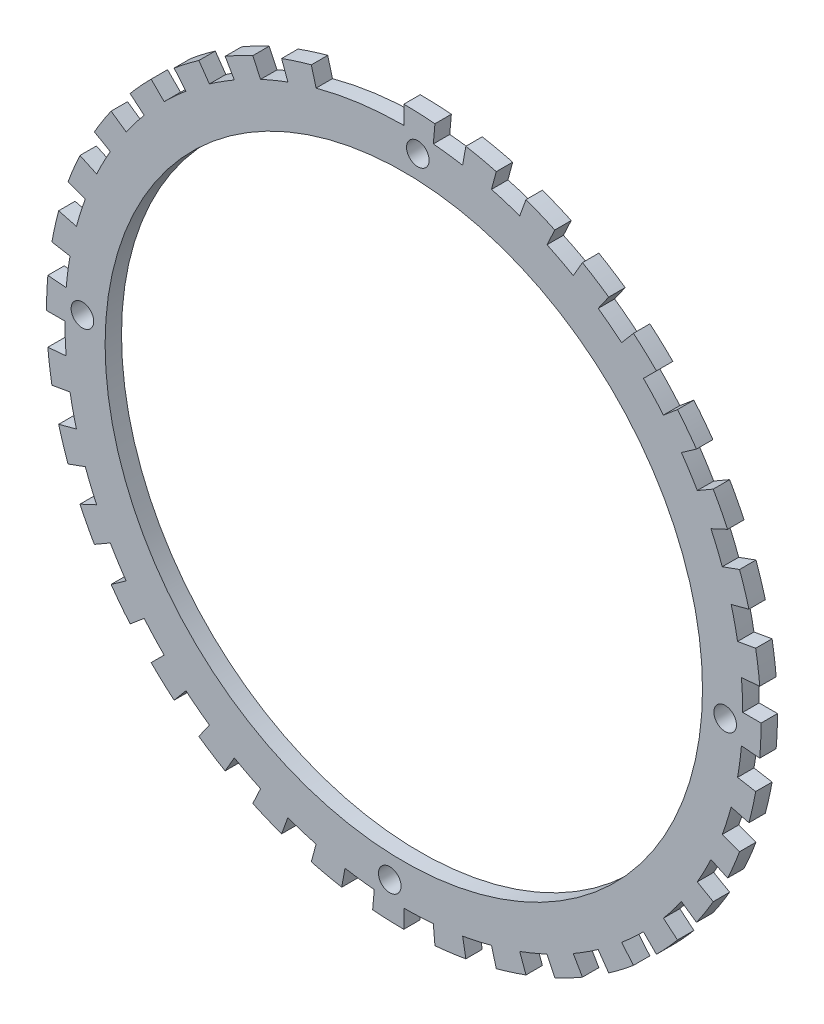
from build123d import *

# Parameters (mm, degrees)
SKETCH1_R           = 65
SKETCH1_R_2         = 2.4585
BOSS_EXTRUDE1_DEPTH = 3.571875


with BuildPart() as part:
    # Sketch1 → Boss-Extrude1 (new body)
    with BuildSketch(Plane.XY):
        with BuildLine():
            Line((0, 77.75), (0, 73.75))
            Line((0, 73.75), (-0.307678606, 73.749358193))
            ThreePointArc((-0.307678606, 73.749358193), (-6.580976275, 73.455791135), (-12.806553103, 72.629571785))
            ThreePointArc((-12.806553103, 72.629571785), (-15.962421528, 72.001830525), (-19.087904576, 71.237029689))
            Line((-19.087904576, 71.237029689), (-20.123180757, 75.100732994))
            ThreePointArc((-20.123180757, 75.100732994), (-23.379875911, 74.151492921), (-26.592066144, 73.061101266))
            Line((-26.592066144, 73.061101266), (-25.22398557, 69.302330783))
            ThreePointArc((-25.22398557, 69.302330783), (-28.222903137, 68.136115523), (-31.168096803, 66.840199294))
            Line((-31.168096803, 66.840199294), (-32.85856985, 70.465430442))
            ThreePointArc((-32.85856985, 70.465430442), (-35.900954679, 68.96509228), (-38.875, 67.333475144))
            Line((-38.875, 67.333475144), (-36.875, 63.869373529))
            ThreePointArc((-36.875, 63.869373529), (-39.625846116, 62.200119129), (-42.301262181, 60.412463266))
            Line((-42.301262181, 60.412463266), (-44.595567926, 63.689071443))
            ThreePointArc((-44.595567926, 63.689071443), (-47.331201105, 61.683222208), (-49.976736653, 59.559955453))
            Line((-49.976736653, 59.559955453), (-47.405586214, 56.49577768))
            ThreePointArc((-47.405586214, 56.49577768), (-49.824777812, 54.37420359), (-52.149125113, 52.149125113))
            Line((-52.149125113, 52.149125113), (-54.977552237, 54.977552237))
            ThreePointArc((-54.977552237, 54.977552237), (-57.323312937, 52.527138642), (-59.559955453, 49.976736653))
            Line((-59.559955453, 49.976736653), (-56.49577768, 47.405586214))
            ThreePointArc((-56.49577768, 47.405586214), (-58.509808846, 44.896155389), (-60.412463266, 42.301262181))
            Line((-60.412463266, 42.301262181), (-63.689071443, 44.595567926))
            ThreePointArc((-63.689071443, 44.595567926), (-65.573684912, 41.775044549), (-67.333475144, 38.875))
            Line((-67.333475144, 38.875), (-63.869373529, 36.875))
            ThreePointArc((-63.869373529, 36.875), (-65.417048947, 34.053960226), (-66.840199294, 31.168096803))
            Line((-66.840199294, 31.168096803), (-70.465430442, 32.85856985))
            ThreePointArc((-70.465430442, 32.85856985), (-71.831633653, 29.753636866), (-73.061101266, 26.592066144))
            Line((-73.061101266, 26.592066144), (-69.302330783, 25.22398557))
            ThreePointArc((-69.302330783, 25.22398557), (-70.336625118, 22.177052713), (-71.237029689, 19.087904576))
            Line((-71.237029689, 19.087904576), (-75.100732994, 20.123180757))
            ThreePointArc((-75.100732994, 20.123180757), (-75.907014554, 16.828179984), (-76.568802797, 13.501145814))
            Line((-76.568802797, 13.501145814), (-72.629571785, 12.806553103))
            ThreePointArc((-72.629571785, 12.806553103), (-73.119058526, 9.626306676), (-73.469358984, 6.427736028))
            Line((-73.469358984, 6.427736028), (-77.454137777, 6.776358999))
            ThreePointArc((-77.454137777, 6.776358999), (-77.675999228, 3.391407368), (-77.75, 0))
            Line((-77.75, 0), (-73.75, 0))
            ThreePointArc((-73.75, 0), (-73.679806342, -3.216929818), (-73.469358984, -6.427736028))
            Line((-73.469358984, -6.427736028), (-77.454137777, -6.776358999))
            ThreePointArc((-77.454137777, -6.776358999), (-77.084837972, -10.148411445), (-76.568802797, -13.501145814))
            Line((-76.568802797, -13.501145814), (-72.629571785, -12.806553103))
            ThreePointArc((-72.629571785, -12.806553103), (-72.001830525, -15.962421528), (-71.237029689, -19.087904576))
            Line((-71.237029689, -19.087904576), (-75.100732994, -20.123180757))
            ThreePointArc((-75.100732994, -20.123180757), (-74.151492921, -23.379875911), (-73.061101266, -26.592066144))
            Line((-73.061101266, -26.592066144), (-69.302330783, -25.22398557))
            ThreePointArc((-69.302330783, -25.22398557), (-68.136115523, -28.222903137), (-66.840199294, -31.168096803))
            Line((-66.840199294, -31.168096803), (-70.465430442, -32.85856985))
            ThreePointArc((-70.465430442, -32.85856985), (-68.96509228, -35.900954679), (-67.333475144, -38.875))
            Line((-67.333475144, -38.875), (-63.869373529, -36.875))
            ThreePointArc((-63.869373529, -36.875), (-62.200119129, -39.625846116), (-60.412463266, -42.301262181))
            Line((-60.412463266, -42.301262181), (-63.689071443, -44.595567926))
            ThreePointArc((-63.689071443, -44.595567926), (-61.683222208, -47.331201105), (-59.559955453, -49.976736653))
            Line((-59.559955453, -49.976736653), (-56.49577768, -47.405586214))
            ThreePointArc((-56.49577768, -47.405586214), (-54.37420359, -49.824777812), (-52.149125113, -52.149125113))
            Line((-52.149125113, -52.149125113), (-54.977552237, -54.977552237))
            ThreePointArc((-54.977552237, -54.977552237), (-52.527138642, -57.323312937), (-49.976736653, -59.559955453))
            Line((-49.976736653, -59.559955453), (-47.405586214, -56.49577768))
            ThreePointArc((-47.405586214, -56.49577768), (-44.896155389, -58.509808846), (-42.301262181, -60.412463266))
            Line((-42.301262181, -60.412463266), (-44.595567926, -63.689071443))
            ThreePointArc((-44.595567926, -63.689071443), (-41.775044549, -65.573684912), (-38.875, -67.333475144))
            Line((-38.875, -67.333475144), (-36.875, -63.869373529))
            ThreePointArc((-36.875, -63.869373529), (-34.053960226, -65.417048947), (-31.168096803, -66.840199294))
            Line((-31.168096803, -66.840199294), (-32.85856985, -70.465430442))
            ThreePointArc((-32.85856985, -70.465430442), (-29.753636866, -71.831633653), (-26.592066144, -73.061101266))
            Line((-26.592066144, -73.061101266), (-25.22398557, -69.302330783))
            ThreePointArc((-25.22398557, -69.302330783), (-22.177052713, -70.336625118), (-19.087904576, -71.237029689))
            Line((-19.087904576, -71.237029689), (-20.123180757, -75.100732994))
            ThreePointArc((-20.123180757, -75.100732994), (-16.828179984, -75.907014554), (-13.501145814, -76.568802797))
            Line((-13.501145814, -76.568802797), (-12.806553103, -72.629571785))
            ThreePointArc((-12.806553103, -72.629571785), (-9.626306676, -73.119058526), (-6.427736028, -73.469358984))
            Line((-6.427736028, -73.469358984), (-6.776358999, -77.454137777))
            ThreePointArc((-6.776358999, -77.454137777), (-3.391407368, -77.675999228), (0, -77.75))
            Line((0, -77.75), (0, -73.75))
            ThreePointArc((0, -73.75), (3.216929818, -73.679806342), (6.427736028, -73.469358984))
            Line((6.427736028, -73.469358984), (6.776358999, -77.454137777))
            ThreePointArc((6.776358999, -77.454137777), (10.148411445, -77.084837972), (13.501145814, -76.568802797))
            Line((13.501145814, -76.568802797), (12.806553103, -72.629571785))
            ThreePointArc((12.806553103, -72.629571785), (15.962421528, -72.001830525), (19.087904576, -71.237029689))
            Line((19.087904576, -71.237029689), (20.123180757, -75.100732994))
            ThreePointArc((20.123180757, -75.100732994), (23.379875911, -74.151492921), (26.592066144, -73.061101266))
            Line((26.592066144, -73.061101266), (25.22398557, -69.302330783))
            ThreePointArc((25.22398557, -69.302330783), (28.222903137, -68.136115523), (31.168096803, -66.840199294))
            Line((31.168096803, -66.840199294), (32.85856985, -70.465430442))
            ThreePointArc((32.85856985, -70.465430442), (35.900954679, -68.96509228), (38.875, -67.333475144))
            Line((38.875, -67.333475144), (36.875, -63.869373529))
            ThreePointArc((36.875, -63.869373529), (39.625846116, -62.200119129), (42.301262181, -60.412463266))
            Line((42.301262181, -60.412463266), (44.595567926, -63.689071443))
            ThreePointArc((44.595567926, -63.689071443), (47.331201105, -61.683222208), (49.976736653, -59.559955453))
            Line((49.976736653, -59.559955453), (47.405586214, -56.49577768))
            ThreePointArc((47.405586214, -56.49577768), (49.824777812, -54.37420359), (52.149125113, -52.149125113))
            Line((52.149125113, -52.149125113), (54.977552237, -54.977552237))
            ThreePointArc((54.977552237, -54.977552237), (57.323312937, -52.527138642), (59.559955453, -49.976736653))
            Line((59.559955453, -49.976736653), (56.49577768, -47.405586214))
            ThreePointArc((56.49577768, -47.405586214), (58.509808846, -44.896155389), (60.412463266, -42.301262181))
            Line((60.412463266, -42.301262181), (63.689071443, -44.595567926))
            ThreePointArc((63.689071443, -44.595567926), (65.573684912, -41.775044549), (67.333475144, -38.875))
            Line((67.333475144, -38.875), (63.869373529, -36.875))
            ThreePointArc((63.869373529, -36.875), (65.417048947, -34.053960226), (66.840199294, -31.168096803))
            Line((66.840199294, -31.168096803), (70.465430442, -32.85856985))
            ThreePointArc((70.465430442, -32.85856985), (71.831633653, -29.753636866), (73.061101266, -26.592066144))
            Line((73.061101266, -26.592066144), (69.302330783, -25.22398557))
            ThreePointArc((69.302330783, -25.22398557), (70.336625118, -22.177052713), (71.237029689, -19.087904576))
            Line((71.237029689, -19.087904576), (75.100732994, -20.123180757))
            ThreePointArc((75.100732994, -20.123180757), (75.907014554, -16.828179984), (76.568802797, -13.501145814))
            Line((76.568802797, -13.501145814), (72.629571785, -12.806553103))
            ThreePointArc((72.629571785, -12.806553103), (73.119058526, -9.626306676), (73.469358984, -6.427736028))
            Line((73.469358984, -6.427736028), (77.454137777, -6.776358999))
            ThreePointArc((77.454137777, -6.776358999), (77.675999228, -3.391407368), (77.75, 0))
            Line((77.75, 0), (73.75, 0))
            ThreePointArc((73.75, 0), (73.679806342, 3.216929818), (73.469358984, 6.427736028))
            Line((73.469358984, 6.427736028), (77.454137777, 6.776358999))
            ThreePointArc((77.454137777, 6.776358999), (77.084837972, 10.148411445), (76.568802797, 13.501145814))
            Line((76.568802797, 13.501145814), (72.629571785, 12.806553103))
            ThreePointArc((72.629571785, 12.806553103), (72.001830525, 15.962421528), (71.237029689, 19.087904576))
            Line((71.237029689, 19.087904576), (75.100732994, 20.123180757))
            ThreePointArc((75.100732994, 20.123180757), (74.151492921, 23.379875911), (73.061101266, 26.592066144))
            Line((73.061101266, 26.592066144), (69.302330783, 25.22398557))
            ThreePointArc((69.302330783, 25.22398557), (68.136115523, 28.222903137), (66.840199294, 31.168096803))
            Line((66.840199294, 31.168096803), (70.465430442, 32.85856985))
            ThreePointArc((70.465430442, 32.85856985), (68.96509228, 35.900954679), (67.333475144, 38.875))
            Line((67.333475144, 38.875), (63.869373529, 36.875))
            ThreePointArc((63.869373529, 36.875), (62.200119129, 39.625846116), (60.412463266, 42.301262181))
            Line((60.412463266, 42.301262181), (63.689071443, 44.595567926))
            ThreePointArc((63.689071443, 44.595567926), (61.683222208, 47.331201105), (59.559955453, 49.976736653))
            Line((59.559955453, 49.976736653), (56.49577768, 47.405586214))
            ThreePointArc((56.49577768, 47.405586214), (54.37420359, 49.824777812), (52.149125113, 52.149125113))
            Line((52.149125113, 52.149125113), (54.977552237, 54.977552237))
            ThreePointArc((54.977552237, 54.977552237), (52.527138642, 57.323312937), (49.976736653, 59.559955453))
            Line((49.976736653, 59.559955453), (47.405586214, 56.49577768))
            ThreePointArc((47.405586214, 56.49577768), (44.896155389, 58.509808846), (42.301262181, 60.412463266))
            Line((42.301262181, 60.412463266), (44.595567926, 63.689071443))
            ThreePointArc((44.595567926, 63.689071443), (41.775044549, 65.573684912), (38.875, 67.333475144))
            Line((38.875, 67.333475144), (36.875, 63.869373529))
            ThreePointArc((36.875, 63.869373529), (34.053960226, 65.417048947), (31.168096803, 66.840199294))
            Line((31.168096803, 66.840199294), (32.85856985, 70.465430442))
            ThreePointArc((32.85856985, 70.465430442), (29.753636866, 71.831633653), (26.592066144, 73.061101266))
            Line((26.592066144, 73.061101266), (25.22398557, 69.302330783))
            ThreePointArc((25.22398557, 69.302330783), (22.177052713, 70.336625118), (19.087904576, 71.237029689))
            Line((19.087904576, 71.237029689), (20.123180757, 75.100732994))
            ThreePointArc((20.123180757, 75.100732994), (16.828179984, 75.907014554), (13.501145814, 76.568802797))
            Line((13.501145814, 76.568802797), (12.806553103, 72.629571785))
            ThreePointArc((12.806553103, 72.629571785), (9.626306676, 73.119058526), (6.427736028, 73.469358984))
            Line((6.427736028, 73.469358984), (6.776358999, 77.454137777))
            ThreePointArc((6.776358999, 77.454137777), (3.391407368, 77.675999228), (0, 77.75))
        make_face()
        Circle(SKETCH1_R, mode=Mode.SUBTRACT)
        with Locations((3.053357116, 69.933375511)):
            Circle(SKETCH1_R_2, mode=Mode.SUBTRACT)
        with Locations((69.933375511, -3.053357116)):
            Circle(SKETCH1_R_2, mode=Mode.SUBTRACT)
        with Locations((-3.053357116, -69.933375511)):
            Circle(SKETCH1_R_2, mode=Mode.SUBTRACT)
        with Locations((-69.933375511, 3.053357116)):
            Circle(SKETCH1_R_2, mode=Mode.SUBTRACT)
    extrude(amount=BOSS_EXTRUDE1_DEPTH)


solid = part.part
